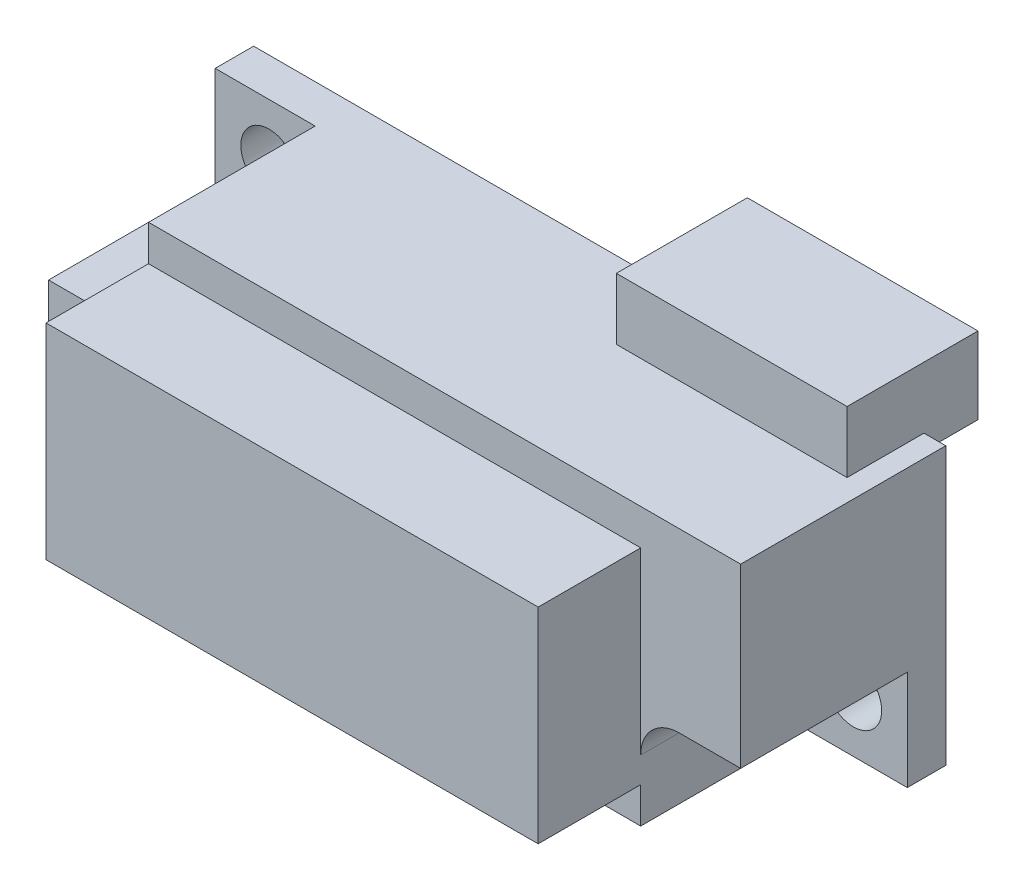
from build123d import *

# Parameters (mm, degrees)
SKETCH_1_W           = 27
SKETCH_1_H           = 10.8
EXTRUDE_1_DEPTH      = 12
SKETCH_2_W           = 3.9
SKETCH_2_H           = 3.9
CUT_EXTRUDE_2_DEPTH  = 10.5
FILLET_3_R           = 1.5
FILLET_4_R           = 1.5
SKETCH_3_R           = 1.1
CUT_EXTRUDE_3_DEPTH  = 10.5
SKETCH_4_W           = 27
SKETCH_4_H           = 10.8
SKETCH_4_W_2         = 19.2
SKETCH_4_H_2         = 8
CUT_EXTRUDE_4_DEPTH  = 4
EXTRUDE_2_DEPTH      = 2.108
EXTRUDE_2_DEPTH_BACK = 3
SKETCH_5_W           = 9
SKETCH_5_H           = 3


with BuildPart() as part:
    # 스케치1 → 보스-돌출1 (new body)
    with BuildSketch(Plane.XY):
        with Locations((-12.645283423, 9.45123242)):
            Rectangle(SKETCH_1_W, SKETCH_1_H)
    extrude(amount=EXTRUDE_1_DEPTH)

    # 스케치2 → 컷-돌출2 (cut)
    with BuildSketch(Plane.XY.offset(12)):
        with Locations((-24.195283423, 12.90123242)):
            Rectangle(SKETCH_2_W, SKETCH_2_H)
        with Locations((-1.095283423, 6.00123242)):
            Rectangle(SKETCH_2_W, SKETCH_2_H)
    extrude(amount=-CUT_EXTRUDE_2_DEPTH, mode=Mode.SUBTRACT)

    # 필렛3
    fillet_3_edges = [part.edges().sort_by_distance(p)[0] for p in [
        (-22.245283423, 10.95123242, 6.75),
    ]]
    fillet(fillet_3_edges, radius=FILLET_3_R)

    # 필렛4
    fillet_4_edges = [part.edges().sort_by_distance(p)[0] for p in [
        (-3.045283423, 7.95123242, 6.75),
    ]]
    fillet(fillet_4_edges, radius=FILLET_4_R)

    # 스케치3 → 컷-돌출3 (cut)
    with BuildSketch(Plane.XY.offset(1.5)):
        with Locations((-24.045283423, 12.75123242)):
            Circle(SKETCH_3_R)
        with Locations((-1.245283423, 6.15123242)):
            Circle(SKETCH_3_R)
    extrude(amount=-CUT_EXTRUDE_3_DEPTH, mode=Mode.SUBTRACT)

    # 스케치4 → 컷-돌출4 (cut)
    with BuildSketch(Plane.XY.offset(12)):
        with Locations((-12.645283423, 9.45123242)):
            Rectangle(SKETCH_4_W, SKETCH_4_H)
        with Locations((-12.645283423, 9.45123242)):
            Rectangle(SKETCH_4_W_2, SKETCH_4_H_2, mode=Mode.SUBTRACT)
    extrude(amount=-CUT_EXTRUDE_4_DEPTH, mode=Mode.SUBTRACT)

    # 스케치5 → 보스-돌출2 (add, two sides: drawn at the far end of the back side and taken through both)
    with BuildSketch(Plane(origin=(0, 0, 0), x_dir=(-1, 0, 0), z_dir=(0, 0, -1)).offset(-EXTRUDE_2_DEPTH_BACK)):
        with Locations((4.495283423, 15.75123242)):
            Rectangle(SKETCH_5_W, SKETCH_5_H)
    extrude(amount=EXTRUDE_2_DEPTH + EXTRUDE_2_DEPTH_BACK)


solid = part.part
